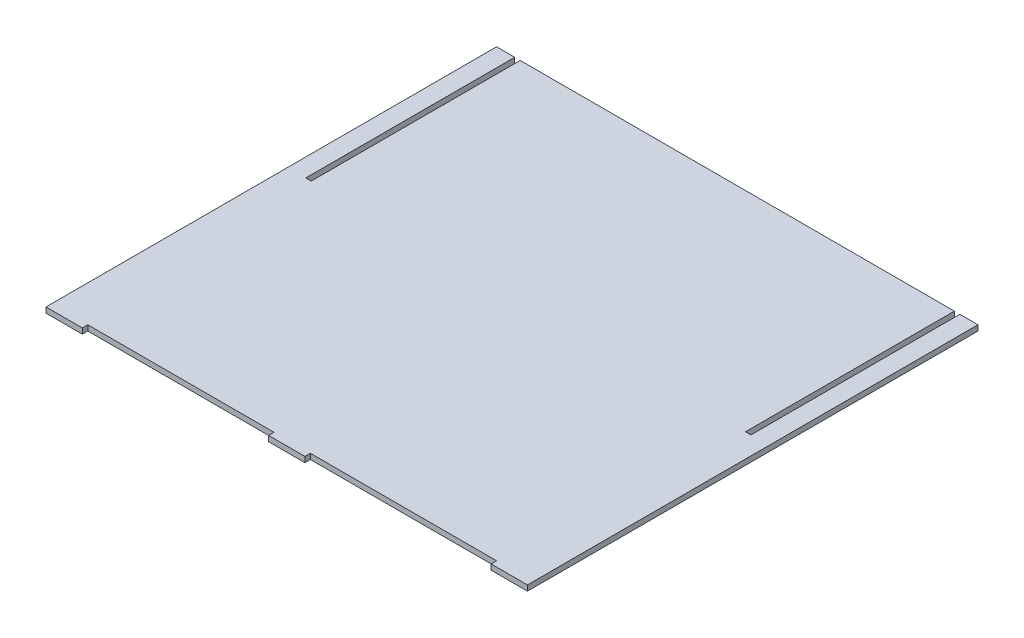
from build123d import *

# Parameters (mm, degrees)
BOSS_EXTRUDE1_DEPTH = 6
SKETCH2_W           = 6
SKETCH2_H           = 230
CUT_EXTRUDE1_DEPTH  = 6
LPATTERN1_COUNT     = 2
LPATTERN1_PITCH     = 484


with BuildPart() as part:
    # Sketch1 → Boss-Extrude1 (new body)
    with BuildSketch(Plane(origin=(0, 0, 0), x_dir=(1, 0, 0), z_dir=(0, 1, 0))):
        Polygon((-530, 0), (-490, 0), (-490, 6), (-285, 6), (-285, 0), (-245, 0), (-245, 6), (-40, 6), (-40, 0), (0, 0), (0, 496), (-530, 496), align=None)
    extrude(amount=BOSS_EXTRUDE1_DEPTH)

    # Sketch2 → Cut-Extrude1 (cut)
    with BuildSketch(Plane(origin=(0, 6, 0), x_dir=(1, 0, 0), z_dir=(0, 1, 0))):
        with Locations((-23, 381)):
            Rectangle(SKETCH2_W, SKETCH2_H)
    cut_extrude1 = extrude(amount=-CUT_EXTRUDE1_DEPTH, mode=Mode.SUBTRACT)

    # LPattern1: Cut-Extrude1 ×2
    with Locations(*[(-i * LPATTERN1_PITCH, 0, 0) for i in range(1, LPATTERN1_COUNT)]):
        add(cut_extrude1, mode=Mode.SUBTRACT)


solid = part.part
